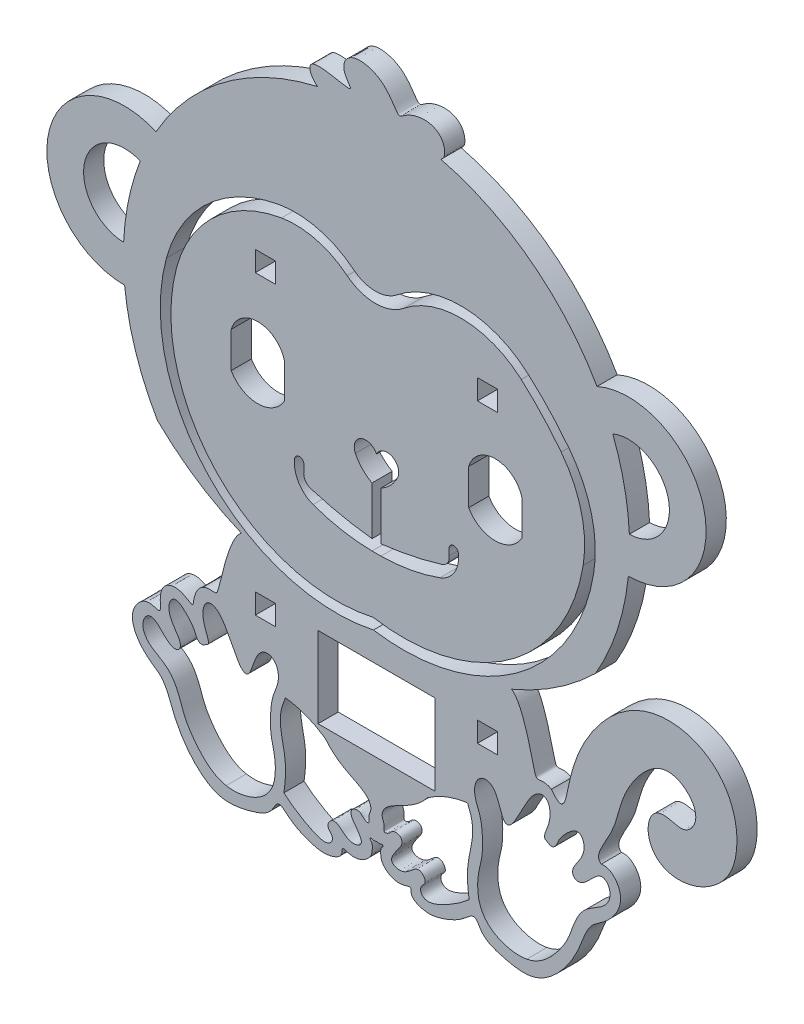
from build123d import *

# Parameters (mm, degrees)
MODEL_W               = 4.75
MODEL_H               = 4.75
MODEL_W_2             = 27.5
MODEL_H_2             = 19
BOSS_EXTRUDE1_DEPTH   = 4.75
BOSS_EXTRUDE1_2_DEPTH = 4.75


with BuildPart() as part:
    # Model → Boss-Extrude1 (new body)
    with BuildSketch(Plane.XY):
        with BuildLine():
            ThreePointArc((-368.648535438, 496.252173352), (-390.614540969, 486.143224047), (-406.641533995, 468.037099404))
            ThreePointArc((-406.641533995, 468.037099404), (-431.911918909, 455.12113969), (-414.015985287, 433.095020448))
            ThreePointArc((-414.015985287, 433.095020448), (-411.431056442, 420.844790734), (-406.306877408, 409.421447336))
            add(Edge.make_bspline(
                [(-406.306877408, 409.421447336), (-400.570314381, 403.800956643), (-393.8462394, 399.364042204), (-386.551251239, 396.327251189)],
                knots=[0, 0, 0, 0, 0.429948541, 0.429948541, 0.429948541, 0.429948541], degree=3))
            add(Edge.make_bspline(
                [(-386.551251239, 396.327251189), (-386.916052394, 396.079204413), (-387.365984237, 395.634433922), (-387.896797281, 394.898644088), (-388.503330161, 393.757203334), (-389.171452603, 392.131003368), (-389.577925954, 391.014654975), (-389.970270784, 389.819275468), (-390.419319319, 388.323421516), (-390.83332726, 386.804935246), (-391.201587088, 385.34636593), (-391.516679205, 384.035346949), (-391.781698399, 382.944281063), (-391.975355466, 382.209449772), (-392.15403089, 381.664820315), (-392.336737386, 381.31109681), (-392.551498562, 381.129911234), (-392.833479669, 381.082225409), (-393.211479982, 381.115525432), (-393.693425125, 381.169472404), (-394.261194431, 381.182617586), (-394.881047474, 381.099420015), (-395.510435114, 380.877573231), (-396.105936728, 380.494485307), (-396.631517428, 379.95585235), (-397.063963964, 379.297531395), (-397.39210439, 378.573969962), (-397.617276013, 377.849585475), (-397.753517497, 377.188797135), (-397.82736951, 376.647023839), (-397.879059879, 376.260334721), (-397.959633552, 376.038465419), (-398.114782848, 375.972462073), (-398.366034123, 376.040823891), (-398.706936261, 376.21469148), (-399.120091801, 376.460086445), (-399.591458011, 376.741171495), (-400.117952431, 377.022315753), (-400.699774201, 377.268862798), (-401.463798734, 377.484035353), (-402.300244633, 377.553822048), (-403.174091852, 377.426716269), (-404.002173047, 377.065864722), (-404.698224792, 376.46441147), (-405.153470998, 375.811835942), (-405.461269956, 375.032169593), (-405.619922332, 374.166940367), (-405.657953521, 373.27889911), (-405.626485489, 372.442499072), (-405.587522811, 371.731075977), (-405.603727217, 371.205296174), (-405.727364814, 370.900755869), (-405.990085682, 370.81668236), (-406.39105056, 370.902146782), (-406.905602715, 371.07475403), (-407.496249881, 371.243305804), (-408.122207542, 371.327500075), (-408.751072773, 371.282728006), (-409.35960202, 371.097539496), (-409.931191749, 370.782809916), (-410.454421679, 370.36348433), (-410.921225043, 369.869653892), (-411.325051593, 369.32694511), (-411.659572418, 368.750331411), (-411.919102239, 368.147846593), (-412.098696202, 367.522400938), (-412.194371621, 366.874422897), (-412.203287138, 366.20397783), (-412.092164868, 365.237355517), (-411.795780763, 364.240492853), (-411.25356719, 363.0979097), (-410.505546493, 362.004000685), (-409.628552466, 361.020862692), (-408.940714048, 360.363039305), (-408.261699769, 359.795455705), (-407.719269628, 359.383631865), (-407.21381394, 359.028246689), (-406.753242924, 358.71792316), (-406.337217025, 358.432587935), (-405.958407604, 358.146100067), (-405.606436892, 357.832150323), (-405.270933307, 357.469037169), (-404.945150571, 357.045248498), (-404.628769556, 356.563710073), (-404.325203667, 356.036561227), (-404.039420225, 355.480831591), (-403.775511082, 354.913678765), (-403.486293011, 354.234906798), (-403.22438966, 353.563780813), (-402.971971356, 352.893055429), (-402.704512752, 352.203026621), (-402.401681187, 351.478012783), (-402.062584898, 350.721085445), (-401.674639208, 349.927966936), (-401.239024686, 349.111007443), (-400.763113802, 348.289788183), (-400.254340005, 347.481959495), (-399.722634495, 346.692998852), (-399.163365939, 345.932140679), (-398.574323946, 345.19923963), (-397.949478676, 344.488835597), (-397.28186749, 343.797089708), (-396.693729261, 343.232918759), (-395.94666487, 342.573889335), (-395.145878925, 341.947793479), (-394.290902186, 341.375211916), (-393.384167186, 340.882126765), (-392.430043668, 340.491703263), (-391.606002687, 340.243986907), (-390.756002743, 340.079446261), (-389.883129061, 339.998262902), (-388.990604918, 339.995014447), (-388.082210988, 340.060658996), (-387.162607569, 340.183979577), (-386.237707408, 340.353267946), (-385.315001235, 340.557855636), (-384.403963907, 340.789827334), (-383.516286063, 341.045384095), (-382.66652457, 341.327024633), (-381.871318875, 341.642937555), (-381.146754324, 342.002777686), (-380.506140062, 342.414272763), (-379.957720387, 342.879646699), (-379.50217975, 343.391768319), (-379.130782998, 343.931240964), (-378.821858803, 344.461005534), (-378.544703377, 344.932108886), (-378.267774642, 345.29593373), (-377.965518245, 345.51436395), (-377.625879138, 345.570992742), (-377.257148561, 345.481328236), (-376.875804119, 345.278776475), (-376.496250149, 345.00253689), (-376.11706805, 344.682307942), (-375.720845967, 344.335154988), (-375.283150649, 343.970625574), (-374.779103973, 343.593551859), (-374.190278948, 343.207542556), (-373.377688666, 342.741091189), (-372.449841911, 342.284943077), (-371.448923671, 341.861784637), (-370.434447105, 341.496921291), (-369.457107924, 341.211628122), (-368.685864943, 341.035221995), (-367.964373903, 340.924859402), (-367.285516994, 340.881136877), (-366.635919607, 340.902071878), (-366.001452121, 340.984188477), (-365.373937537, 341.123915256), (-364.75630659, 341.318535957), (-364.170945702, 341.568094094), (-363.657947564, 341.87428189), (-363.258368215, 342.235110671), (-362.999601239, 342.639822419), (-362.882834785, 343.065290294), (-362.862380856, 343.467877411), (-362.860328863, 343.794256059), (-362.800804618, 344.002021381), (-362.645316427, 344.082202864), (-362.403915174, 344.064482859), (-362.091030238, 343.983757423), (-361.712216892, 343.868949898), (-361.271123238, 343.746963048), (-360.772201451, 343.643387937), (-360.225145899, 343.584551667), (-359.643851104, 343.593953505), (-359.045609545, 343.68889199), (-358.331130904, 343.914571841), (-357.653031997, 344.271758954), (-357.055699253, 344.71601695), (-356.577458743, 345.17871164), (-356.233391408, 345.621031596), (-356.033125086, 345.975351534), (-355.902737419, 346.342883089), (-355.820827463, 346.757252518), (-355.769760706, 347.236551212), (-355.745106949, 347.759570584), (-355.762413964, 348.248781386), (-355.838587496, 348.623368474), (-355.977712536, 348.837568218), (-356.150848594, 348.941800594), (-356.292732028, 349.075710758), (-356.33646563, 349.288102762), (-356.236344626, 349.443149765), (-355.997125235, 349.455364951), (-355.677539018, 349.382302231), (-355.345578077, 349.318848286), (-355.1000792, 349.319880609), (-354.932396923, 349.356987082), (-354.827970147, 349.397996872), (-354.777593989, 349.422562594)],
                knots=[0, 0, 0, 0, 0, 0, 0.02, 0.025, 0.03, 0.035, 0.04, 0.045, 0.05, 0.06, 0.065, 0.07, 0.075, 0.08, 0.085, 0.09, 0.095, 0.1, 0.105, 0.11, 0.115, 0.12, 0.125, 0.13, 0.135, 0.14, 0.145, 0.15, 0.155, 0.16, 0.165, 0.17, 0.175, 0.18, 0.185, 0.19, 0.195, 0.2, 0.205, 0.21, 0.22, 0.225, 0.23, 0.235, 0.24, 0.245, 0.25, 0.255, 0.26, 0.265, 0.27, 0.275, 0.28, 0.285, 0.29, 0.295, 0.3, 0.305, 0.31, 0.315, 0.32, 0.325, 0.33, 0.335, 0.34, 0.345, 0.35, 0.355, 0.36, 0.375, 0.38, 0.39, 0.395, 0.4, 0.405, 0.41, 0.415, 0.42, 0.425, 0.43, 0.435, 0.44, 0.445, 0.45, 0.455, 0.46, 0.465, 0.47, 0.48, 0.485, 0.49, 0.495, 0.5, 0.51, 0.515, 0.52, 0.525, 0.53, 0.54, 0.545, 0.55, 0.555, 0.56, 0.565, 0.575, 0.58, 0.585, 0.59, 0.595, 0.6, 0.605, 0.61, 0.615, 0.62, 0.625, 0.63, 0.635, 0.64, 0.645, 0.65, 0.655, 0.66, 0.665, 0.67, 0.675, 0.68, 0.685, 0.69, 0.695, 0.7, 0.705, 0.71, 0.715, 0.72, 0.725, 0.73, 0.735, 0.74, 0.745, 0.755, 0.76, 0.765, 0.77, 0.775, 0.78, 0.785, 0.79, 0.795, 0.8, 0.805, 0.81, 0.815, 0.82, 0.825, 0.83, 0.835, 0.84, 0.845, 0.85, 0.855, 0.86, 0.865, 0.87, 0.875, 0.88, 0.885, 0.89, 0.895, 0.905, 0.91, 0.915, 0.92, 0.925, 0.93, 0.935, 0.94, 0.945, 0.95, 0.955, 0.96, 0.965, 0.97, 0.975, 0.98, 0.985, 0.99, 0.995, 1, 1, 1, 1, 1, 1], degree=5))
            add(Edge.make_bspline(
                [(-354.777593989, 349.422562594), (-354.727217831, 349.397996872), (-354.622791055, 349.356987082), (-354.455108777, 349.319880609), (-354.2096099, 349.318848286), (-353.87764896, 349.382302231), (-353.558062742, 349.455364951), (-353.318843352, 349.443149765), (-353.218722348, 349.288102762), (-353.262455949, 349.075710758), (-353.404339383, 348.941800594), (-353.577475441, 348.837568218), (-353.716600481, 348.623368474), (-353.792774013, 348.248781386), (-353.810081029, 347.759570584), (-353.785427271, 347.236551212), (-353.734360514, 346.757252518), (-353.652450559, 346.342883089), (-353.522062892, 345.975351534), (-353.321796569, 345.621031596), (-352.977729235, 345.17871164), (-352.499488725, 344.71601695), (-351.902155981, 344.271758954), (-351.224057074, 343.914571841), (-350.509578433, 343.68889199), (-349.911336873, 343.593953505), (-349.330042079, 343.584551667), (-348.782986526, 343.643387937), (-348.284064739, 343.746963048), (-347.842971085, 343.868949898), (-347.46415774, 343.983757423), (-347.151272803, 344.064482859), (-346.909871551, 344.082202864), (-346.754383359, 344.002021381), (-346.694859114, 343.794256059), (-346.692807122, 343.467877411), (-346.672353193, 343.065290294), (-346.555586738, 342.639822419), (-346.296819762, 342.235110671), (-345.897240413, 341.87428189), (-345.384242276, 341.568094094), (-344.798881387, 341.318535957), (-344.18125044, 341.123915256), (-343.553735856, 340.984188477), (-342.91926837, 340.902071878), (-342.269670984, 340.881136877), (-341.590814074, 340.924859402), (-340.869323035, 341.035221995), (-340.098080053, 341.211628122), (-339.120740873, 341.496921291), (-338.106264306, 341.861784637), (-337.105346067, 342.284943077), (-336.177499311, 342.741091189), (-335.364909029, 343.207542556), (-334.776084004, 343.593551859), (-334.272037329, 343.970625574), (-333.83434201, 344.335154988), (-333.438119927, 344.682307942), (-333.058937829, 345.00253689), (-332.679383858, 345.278776475), (-332.298039416, 345.481328236), (-331.929308839, 345.570992742), (-331.589669732, 345.51436395), (-331.287413335, 345.29593373), (-331.0104846, 344.932108886), (-330.733329174, 344.461005534), (-330.42440498, 343.931240964), (-330.053008227, 343.391768319), (-329.59746759, 342.879646699), (-329.049047915, 342.414272763), (-328.408433654, 342.002777686), (-327.683869103, 341.642937555), (-326.888663407, 341.327024633), (-326.038901914, 341.045384095), (-325.151224071, 340.789827334), (-324.240186742, 340.557855636), (-323.31748057, 340.353267946), (-322.392580408, 340.183979577), (-321.472976989, 340.060658996), (-320.564583059, 339.995014447), (-319.672058916, 339.998262902), (-318.799185234, 340.079446261), (-317.949185291, 340.243986907), (-317.125144309, 340.491703263), (-316.171020791, 340.882126765), (-315.264285791, 341.375211916), (-314.409309053, 341.947793479), (-313.608523108, 342.573889335), (-312.861458716, 343.232918759), (-312.273320488, 343.797089708), (-311.605709301, 344.488835597), (-310.980864031, 345.19923963), (-310.391822039, 345.932140679), (-309.832553482, 346.692998852), (-309.300847972, 347.481959495), (-308.792074176, 348.289788183), (-308.316163291, 349.111007443), (-307.88054877, 349.927966936), (-307.492603079, 350.721085445), (-307.15350679, 351.478012783), (-306.850675225, 352.203026621), (-306.583216622, 352.893055429), (-306.330798317, 353.563780813), (-306.068894967, 354.234906798), (-305.779676896, 354.913678765), (-305.515767753, 355.480831591), (-305.22998431, 356.036561227), (-304.926418421, 356.563710073), (-304.610037406, 357.045248498), (-304.28425467, 357.469037169), (-303.948751085, 357.832150323), (-303.596780374, 358.146100067), (-303.217970952, 358.432587935), (-302.801945054, 358.71792316), (-302.341374037, 359.028246689), (-301.83591835, 359.383631865), (-301.293488209, 359.795455705), (-300.61447393, 360.363039305), (-299.926635511, 361.020862692), (-299.049641484, 362.004000685), (-298.301620787, 363.0979097), (-297.759407215, 364.240492853), (-297.463023109, 365.237355517), (-297.35190084, 366.20397783), (-297.360816357, 366.874422897), (-297.456491776, 367.522400938), (-297.636085738, 368.147846593), (-297.89561556, 368.750331411), (-298.230136384, 369.32694511), (-298.633962934, 369.869653892), (-299.100766299, 370.36348433), (-299.623996228, 370.782809916), (-300.195585957, 371.097539496), (-300.773941346, 371.273545454), (-301.244905456, 371.313674079), (-301.589974955, 371.293910279), (-301.80670497, 371.265018138), (-301.898947089, 371.249991702)],
                knots=[0.707071068, 0.707071068, 0.707071068, 0.707071068, 0.707071068, 0.707071068, 0.712071068, 0.717071068, 0.722071068, 0.727071068, 0.732071068, 0.737071068, 0.742071068, 0.747071068, 0.752071068, 0.757071068, 0.762071068, 0.767071068, 0.772071068, 0.777071068, 0.782071068, 0.787071068, 0.792071068, 0.797071068, 0.802071068, 0.812071068, 0.817071068, 0.822071068, 0.827071068, 0.832071068, 0.837071068, 0.842071068, 0.847071068, 0.852071068, 0.857071068, 0.862071068, 0.867071068, 0.872071068, 0.877071068, 0.882071068, 0.887071068, 0.892071068, 0.897071068, 0.902071068, 0.907071068, 0.912071068, 0.917071068, 0.922071068, 0.927071068, 0.932071068, 0.937071068, 0.942071068, 0.947071068, 0.952071068, 0.962071068, 0.967071068, 0.972071068, 0.977071068, 0.982071068, 0.987071068, 0.992071068, 0.997071068, 1.002071068, 1.007071068, 1.012071068, 1.017071068, 1.022071068, 1.027071068, 1.032071068, 1.037071068, 1.042071068, 1.047071068, 1.052071068, 1.057071068, 1.062071068, 1.067071068, 1.072071068, 1.077071068, 1.082071068, 1.087071068, 1.092071068, 1.097071068, 1.102071068, 1.107071068, 1.112071068, 1.117071068, 1.122071068, 1.127071068, 1.132071068, 1.142071068, 1.147071068, 1.152071068, 1.157071068, 1.162071068, 1.167071068, 1.177071068, 1.182071068, 1.187071068, 1.192071068, 1.197071068, 1.207071068, 1.212071068, 1.217071068, 1.222071068, 1.227071068, 1.237071068, 1.242071068, 1.247071068, 1.252071068, 1.257071068, 1.262071068, 1.267071068, 1.272071068, 1.277071068, 1.282071068, 1.287071068, 1.292071068, 1.297071068, 1.302071068, 1.307071068, 1.312071068, 1.317071068, 1.327071068, 1.332071068, 1.347071068, 1.352071068, 1.357071068, 1.362071068, 1.367071068, 1.372071068, 1.377071068, 1.382071068, 1.387071068, 1.392071068, 1.397071068, 1.402071068, 1.407071068, 1.412071068, 1.415831446, 1.415831446, 1.415831446, 1.415831446, 1.415831446, 1.415831446], degree=5))
            add(Edge.make_bspline(
                [(-301.898947089, 371.249991702), (-302.03777992, 371.337842664), (-302.278358106, 371.535036125), (-302.527935786, 371.895313524), (-302.638326758, 372.504569396), (-302.422921716, 373.473093417), (-301.910810817, 374.622658725), (-301.203239072, 375.907021068), (-300.417430607, 377.272852531), (-299.663776374, 378.670412259), (-299.023340821, 380.063869225), (-298.518808306, 381.445147803), (-298.11469187, 382.832378816), (-297.742815902, 384.255163919), (-297.321372994, 385.743083541), (-296.774951218, 387.313965856), (-296.05819531, 388.959584105), (-295.162040147, 390.642897503), (-294.101045993, 392.307630147), (-292.906052001, 393.884476201), (-291.614267711, 395.298727975), (-290.261394711, 396.477163759), (-288.870633099, 397.355559995), (-287.450506474, 397.88487723), (-286.008600232, 398.034757091), (-284.562929688, 397.798008073), (-283.152043236, 397.193839546), (-281.851079655, 396.27377504), (-280.76403377, 395.118025382), (-279.993445178, 393.822748232), (-279.614594112, 392.489509944), (-279.651481692, 391.214486489), (-280.042701572, 390.076155472), (-280.672983329, 389.134306182), (-281.424791372, 388.432592409), (-282.224227316, 388.000042889), (-283.086509475, 387.852497186), (-284.061898655, 387.966698541), (-285.187617596, 388.257647228), (-286.432799241, 388.549506411), (-287.714778317, 388.627521421), (-288.922339625, 388.299673225), (-289.935960884, 387.451354667), (-290.650627543, 386.112012698), (-290.983205819, 384.420926362), (-290.877596402, 382.578851159), (-290.311010342, 380.803687119), (-289.299028152, 379.286710653), (-287.903220924, 378.142688713), (-286.219105708, 377.4170411), (-284.360670175, 377.103581142), (-282.445893609, 377.158636255), (-280.582328457, 377.516407907), (-278.851525965, 378.104383008), (-277.297305988, 378.856918007), (-275.93548394, 379.717384281), (-274.760882323, 380.641693853), (-273.755463023, 381.601444913), (-272.895776168, 382.586894991), (-272.161214125, 383.610945588), (-271.535866394, 384.70099922), (-271.009722971, 385.888830428), (-270.579877607, 387.201933377), (-270.252293644, 388.652401735), (-270.040978563, 390.2346489), (-269.965016257, 391.930118455), (-270.046205794, 393.710009769), (-270.306480744, 395.538773505), (-270.857132325, 397.745077765), (-271.727774145, 399.906931327), (-272.937052277, 401.94602382), (-274.485083983, 403.787796033), (-276.348901152, 405.366769995), (-278.092782759, 406.4785487), (-280.379149882, 407.539092006), (-283.265109328, 408.344541641), (-286.299006859, 408.594090842), (-289.32996603, 408.269637229), (-292.650761978, 407.269272218), (-295.374305071, 405.888080142), (-297.55376872, 404.384775694), (-299.570759796, 402.614165823), (-301.423227661, 400.629872898), (-302.855961089, 398.859622636), (-304.437971019, 396.623488316), (-305.836320205, 394.276384281), (-307.030109551, 391.853114628), (-308.001652746, 389.39378453), (-308.755268533, 386.963327702), (-309.250925564, 385.001542652), (-309.640561499, 383.162221439), (-309.968617434, 381.523898785), (-310.292721218, 380.178229359), (-310.673366326, 379.216827317), (-311.16584039, 378.72093299), (-311.809926861, 378.748147162), (-312.461695262, 379.21039337), (-313.030249288, 379.809050666), (-313.444699739, 380.320105618), (-313.6607794, 380.60362174)],
                knots=[0.011105874, 0.011105874, 0.011105874, 0.011105874, 0.011105874, 0.011105874, 0.021105874, 0.031105874, 0.041105874, 0.051105874, 0.061105874, 0.071105874, 0.081105874, 0.091105874, 0.101105874, 0.111105874, 0.121105874, 0.131105874, 0.141105874, 0.151105874, 0.161105874, 0.171105874, 0.181105874, 0.191105874, 0.201105874, 0.211105874, 0.221105874, 0.231105874, 0.241105874, 0.251105874, 0.261105874, 0.271105874, 0.281105874, 0.291105874, 0.301105874, 0.311105874, 0.321105874, 0.331105874, 0.341105874, 0.351105874, 0.361105874, 0.371105874, 0.381105874, 0.391105874, 0.401105874, 0.411105874, 0.421105874, 0.431105874, 0.441105874, 0.451105874, 0.461105874, 0.471105874, 0.481105874, 0.491105874, 0.501105874, 0.511105874, 0.521105874, 0.531105874, 0.541105874, 0.551105874, 0.561105874, 0.571105874, 0.581105874, 0.591105874, 0.601105874, 0.611105874, 0.621105874, 0.631105874, 0.641105874, 0.651105874, 0.661105874, 0.671105874, 0.681105874, 0.701105874, 0.711105874, 0.721105874, 0.731105874, 0.741105874, 0.751105874, 0.771105874, 0.791105874, 0.801105874, 0.811105874, 0.831105874, 0.841105874, 0.851105874, 0.861105874, 0.871105874, 0.881105874, 0.901105874, 0.911105874, 0.921105874, 0.931105874, 0.941105874, 0.951105874, 0.961105874, 0.971105874, 0.981105874, 0.991105874, 1.001105874, 1.011105874, 1.011105874, 1.011105874, 1.011105874, 1.011105874, 1.011105874], degree=5))
            add(Edge.make_bspline(
                [(-313.6607794, 380.60362174), (-313.737120758, 380.657216991), (-313.932453608, 380.783648044), (-314.256472836, 380.951412883), (-314.716438841, 381.105097359), (-315.293993546, 381.182617586), (-315.861762853, 381.169472404), (-316.343707995, 381.115525432), (-316.721708308, 381.082225409), (-317.003689416, 381.129911234), (-317.218450591, 381.31109681), (-317.401157087, 381.664820315), (-317.579832511, 382.209449772), (-317.773489578, 382.944281063), (-318.038508773, 384.035346949), (-318.353600889, 385.34636593), (-318.721860717, 386.804935246), (-319.135868658, 388.323421516), (-319.584917193, 389.819275468), (-319.977262023, 391.014654975), (-320.383735374, 392.131003368), (-321.051857816, 393.757203334), (-321.658390696, 394.898644088), (-322.18920374, 395.634433922), (-322.639135583, 396.079204413), (-323.003936738, 396.327251189)],
                knots=[0.083874227, 0.083874227, 0.083874227, 0.083874227, 0.083874227, 0.083874227, 0.087168245, 0.092168245, 0.097168245, 0.102168245, 0.107168245, 0.112168245, 0.117168245, 0.122168245, 0.127168245, 0.132168245, 0.137168245, 0.142168245, 0.147168245, 0.157168245, 0.162168245, 0.167168245, 0.172168245, 0.177168245, 0.182168245, 0.187168245, 0.207168245, 0.207168245, 0.207168245, 0.207168245, 0.207168245, 0.207168245], degree=5))
            add(Edge.make_bspline(
                [(-303.24831057, 409.421447336), (-308.985021441, 403.782578576), (-315.709130953, 399.362076466), (-323.003936738, 396.327251189)],
                knots=[0, 0, 0, 0, 0.419257817, 0.419257817, 0.419257817, 0.419257817], degree=3))
            ThreePointArc((-303.24831057, 409.421447336), (-298.124131535, 420.844790734), (-295.53920269, 433.095020448))
            ThreePointArc((-295.53920269, 433.095020448), (-277.643269068, 455.12113969), (-302.913653982, 468.037099404))
            ThreePointArc((-302.913653982, 468.037099404), (-318.490243046, 485.80537303), (-339.811140885, 495.991686882))
            add(Edge.make_bspline(
                [(-368.648535438, 496.252173352), (-368.744458236, 496.318852064), (-368.933155722, 496.46135137), (-369.206763211, 496.702529524), (-369.552638711, 497.078952875), (-369.945448044, 497.635151945), (-370.27396009, 498.258937778), (-370.49029081, 498.914952019), (-370.51070775, 499.541563445), (-370.238365938, 500.064302422), (-369.5990972, 500.417471707), (-368.57162488, 500.562380095), (-367.22355688, 500.508813977), (-365.687080465, 500.304348965), (-364.130399482, 500.021394498), (-362.730437113, 499.744991582), (-361.645780778, 499.560560003), (-360.987783845, 499.541133492), (-360.796409046, 499.736067669), (-361.003653893, 500.155847055), (-361.456239643, 500.775355547), (-361.969645158, 501.546412025), (-362.368346783, 502.406968262), (-362.540769792, 503.292531993), (-362.454363932, 504.143316727), (-362.127001431, 504.906996063), (-361.609010526, 505.54285956), (-360.962354705, 506.024792223), (-360.237689537, 506.346315269), (-359.465109655, 506.519028644), (-358.662050204, 506.563781119), (-357.836770513, 506.503364206), (-356.993360104, 506.355416269), (-356.136711355, 506.123246396), (-355.27524615, 505.794703449), (-354.419874931, 505.352916652), (-353.583850229, 504.783872945), (-352.782377599, 504.085819177), (-352.032065864, 503.276653785), (-351.351103862, 502.405268117), (-350.756796891, 501.550400765), (-350.259062752, 500.800910062), (-349.854900796, 500.240489256), (-349.52240587, 499.930593307), (-349.215031159, 499.894076524), (-348.855526802, 500.098537748), (-348.362085472, 500.475509867), (-347.67170771, 500.938251599), (-346.770031422, 501.402187782), (-345.688786994, 501.792289415), (-344.48987856, 502.045099565), (-343.253856136, 502.112491058), (-342.066559862, 501.964757688), (-341.006667622, 501.593968073), (-340.132609258, 501.01739116), (-339.470394525, 500.280534755), (-339.021946768, 499.447136213), (-338.772548612, 498.589873373), (-338.698846344, 497.780410896), (-338.775989921, 497.080683391), (-338.986639614, 496.531262609), (-339.255348506, 496.227388525), (-339.511863577, 496.0787419), (-339.707309513, 496.014838841), (-339.811140885, 495.991686882)],
                knots=[0, 0, 0, 0, 0, 0, 0.016666667, 0.033333333, 0.05, 0.066666667, 0.083333333, 0.1, 0.116666667, 0.133333333, 0.15, 0.166666667, 0.183333333, 0.2, 0.216666667, 0.233333333, 0.25, 0.266666667, 0.283333333, 0.3, 0.316666667, 0.333333333, 0.35, 0.366666667, 0.383333333, 0.4, 0.416666667, 0.433333333, 0.45, 0.466666667, 0.483333333, 0.5, 0.516666667, 0.533333333, 0.55, 0.566666667, 0.583333333, 0.6, 0.616666667, 0.633333333, 0.65, 0.666666667, 0.683333333, 0.7, 0.716666667, 0.733333333, 0.75, 0.766666667, 0.783333333, 0.8, 0.816666667, 0.833333333, 0.85, 0.866666667, 0.883333333, 0.9, 0.916666667, 0.933333333, 0.95, 0.966666667, 0.983333333, 1, 1, 1, 1, 1, 1], degree=5))
        make_face()
        with BuildLine():
            ThreePointArc((-360.109228344, 463.172409636), (-355.023574668, 461.376916772), (-349.937920992, 463.172409636))
            ThreePointArc((-349.937920992, 463.172409636), (-334.363025482, 468.457169262), (-319.066098648, 462.414811781))
            ThreePointArc((-319.066098648, 462.414811781), (-313.967508105, 457.426827427), (-309.355065595, 451.986148468))
            ThreePointArc((-309.355065595, 451.986148468), (-304.195997116, 441.351918834), (-303.701700245, 429.542664071))
            ThreePointArc((-303.701700245, 429.542664071), (-321.886124129, 400.161128565), (-355.495007283, 392.136736143))
            ThreePointArc((-355.495007283, 392.136736143), (-394.275586165, 404.171275171), (-404.186485857, 443.548140148))
            ThreePointArc((-404.186485857, 443.548140148), (-394.39888219, 459.530167412), (-377.543979657, 467.723740602))
            ThreePointArc((-377.543979657, 467.723740602), (-368.337482707, 467.321748595), (-360.109228344, 463.172409636))
        make_face(mode=Mode.SUBTRACT)
        with BuildLine():
            ThreePointArc((-414.252942121, 441.734311673), (-423.460915188, 453.337573366), (-410.349392029, 460.23035295))
            ThreePointArc((-410.349392029, 460.23035295), (-413.050642353, 451.140507471), (-414.252942121, 441.734311673))
        make_face(mode=Mode.SUBTRACT)
        with BuildLine():
            ThreePointArc((-299.205795948, 460.23035295), (-286.094272789, 453.337573366), (-295.302245857, 441.734311673))
            ThreePointArc((-295.302245857, 441.734311673), (-296.504545624, 451.140507471), (-299.205795948, 460.23035295))
        make_face(mode=Mode.SUBTRACT)
        with BuildLine():
            add(Edge.make_bspline(
                [(-333.358122308, 367.977740368), (-333.290361755, 367.817629105), (-333.133298943, 367.441678276), (-332.892890082, 366.840557198), (-332.595150463, 365.999616132), (-332.308638357, 364.902314582), (-332.141475525, 363.717945794), (-332.114335112, 362.267537937), (-332.281096871, 360.786670891), (-332.577187909, 359.282111454), (-332.905983076, 357.76060121), (-333.18090921, 356.233101176), (-333.340506426, 354.963686123), (-333.415008014, 353.708196346), (-333.40709761, 352.479644492), (-333.331839528, 351.292328084), (-333.220115887, 350.231627248), (-333.120659299, 349.444474437), (-333.050486962, 348.89971713), (-333.009033396, 348.569813497), (-332.992682366, 348.437505192)],
                knots=[0.622689336, 0.622689336, 0.622689336, 0.622689336, 0.622689336, 0.622689336, 0.636363636, 0.654545455, 0.672727273, 0.690909091, 0.709090909, 0.727272727, 0.763636364, 0.781818182, 0.8, 0.818181818, 0.836363636, 0.854545455, 0.872727273, 0.890909091, 0.909090909, 0.921584179, 0.921584179, 0.921584179, 0.921584179, 0.921584179, 0.921584179], degree=5))
            add(Edge.make_bspline(
                [(-332.992682366, 348.437505192), (-333.343906027, 348.120225507), (-333.824014458, 347.716485488), (-334.461763337, 347.22129098), (-335.410749998, 346.543868926), (-336.610270124, 345.771998966), (-337.458184455, 345.259957762), (-338.343593105, 344.761342502), (-339.250749884, 344.294800143), (-340.011503719, 343.939797535), (-340.765327108, 343.634781861), (-341.498336387, 343.399927626), (-342.194270163, 343.260954616), (-342.834629803, 343.243972112), (-343.399118517, 343.367622612), (-343.865755872, 343.635447226), (-344.211639018, 344.029575024), (-344.412105815, 344.500185277), (-344.449574676, 344.981402433), (-344.325623899, 345.415675437), (-344.071473621, 345.774651042), (-343.760441191, 346.083203626), (-343.482450899, 346.39137192), (-343.319866626, 346.74756162), (-343.317818146, 347.165732087), (-343.474111314, 347.614172754), (-343.760566074, 348.038856641), (-344.136137174, 348.377905457), (-344.565239035, 348.581358079), (-345.021850964, 348.617777675), (-345.489937542, 348.477625624), (-345.965019622, 348.177624601), (-346.455316716, 347.764787306), (-346.974988325, 347.304390919), (-347.537500463, 346.868148382), (-348.148507051, 346.521731015), (-348.799947954, 346.3138942), (-349.461067954, 346.26156111), (-350.083419649, 346.353244449), (-350.61345873, 346.562395215), (-351.00279517, 346.857729309), (-351.219399114, 347.214683036), (-351.258452451, 347.62667992), (-351.136866367, 348.093952582), (-350.887549147, 348.613530102), (-350.5539714, 349.166006251), (-350.18403631, 349.712749097), (-349.823472616, 350.212078335), (-349.508405403, 350.632740674), (-349.260221636, 350.965468466), (-349.074676373, 351.242664974), (-348.931979078, 351.525794368), (-348.820413046, 351.868880998), (-348.764412599, 352.280184356), (-348.821881816, 352.714550499), (-349.042131897, 353.107205211), (-349.433490862, 353.39695829), (-349.928679216, 353.55286338), (-350.43120263, 353.567779583), (-350.855375074, 353.453836876), (-351.175249595, 353.236892523), (-351.449806581, 352.952298114), (-351.75531192, 352.646442123), (-352.140488528, 352.375452202), (-352.554274133, 352.209421056), (-352.889463887, 352.210981478), (-353.055293049, 352.410622381), (-353.061864589, 352.771916741), (-353.002652586, 353.211349774), (-352.983205519, 353.643748358), (-353.052664249, 354.030016958), (-353.188312578, 354.38437775), (-353.336896028, 354.741225182), (-353.441501476, 355.131727418), (-353.469045518, 355.561390098), (-353.400841378, 356.021587578), (-353.229005451, 356.495751946), (-352.949742575, 356.968761067), (-352.561183433, 357.430599339), (-352.06414823, 357.875827209), (-351.462176863, 358.304193598), (-350.621751689, 358.804014305), (-349.324079297, 359.468262445), (-347.827421903, 360.190063829), (-346.226641396, 361.09120286), (-344.708489977, 362.244490628), (-343.643340024, 363.307588234), (-343.163184304, 363.85297617), (-342.873464627, 364.209853009), (-342.762777342, 364.350534764)],
                knots=[0, 0, 0, 0, 0, 0, 0.025806452, 0.032258065, 0.038709677, 0.051612903, 0.058064516, 0.064516129, 0.070967742, 0.077419355, 0.083870968, 0.090322581, 0.096774194, 0.103225806, 0.109677419, 0.116129032, 0.122580645, 0.129032258, 0.135483871, 0.141935484, 0.148387097, 0.15483871, 0.161290323, 0.167741935, 0.174193548, 0.180645161, 0.187096774, 0.193548387, 0.2, 0.206451613, 0.212903226, 0.219354839, 0.225806452, 0.232258065, 0.238709677, 0.24516129, 0.251612903, 0.258064516, 0.264516129, 0.270967742, 0.277419355, 0.283870968, 0.290322581, 0.296774194, 0.303225806, 0.309677419, 0.316129032, 0.322580645, 0.329032258, 0.335483871, 0.341935484, 0.348387097, 0.35483871, 0.361290323, 0.367741935, 0.374193548, 0.380645161, 0.387096774, 0.393548387, 0.4, 0.406451613, 0.412903226, 0.419354839, 0.425806452, 0.432258065, 0.438709677, 0.44516129, 0.451612903, 0.458064516, 0.464516129, 0.470967742, 0.477419355, 0.483870968, 0.490322581, 0.496774194, 0.503225806, 0.509677419, 0.516129032, 0.522580645, 0.529032258, 0.535483871, 0.541935484, 0.55483871, 0.574193548, 0.580645161, 0.587096774, 0.591157882, 0.591157882, 0.591157882, 0.591157882, 0.591157882, 0.591157882], degree=5))
            add(Edge.make_bspline(
                [(-342.762777342, 364.350534764), (-338.494372375, 367.353364408), (-333.358122308, 367.977740368)],
                knots=[0, 0, 0, 1, 1, 1], degree=2))
        make_face(mode=Mode.SUBTRACT)
        with BuildLine():
            add(Edge.make_bspline(
                [(-314.620749745, 369.427141197), (-314.560869496, 369.393694465), (-314.439406747, 369.323231887), (-314.25435186, 369.205963501), (-313.999175477, 369.049059854), (-313.639514767, 368.96228854), (-313.243772968, 369.05266282), (-312.867198913, 369.296818527), (-312.566493663, 369.638109808), (-312.355288256, 370.031321462), (-312.183415676, 370.470969369), (-311.979484465, 370.965320575), (-311.677269873, 371.523827157), (-311.253906037, 372.136488917), (-310.724041929, 372.776291707), (-310.124744446, 373.405964272), (-309.503010445, 373.983472804), (-308.903200413, 374.467756401), (-308.352069048, 374.825041115), (-307.85316693, 375.032596821), (-307.400412858, 375.077436111), (-306.986434606, 374.956091264), (-306.615337983, 374.674043003), (-306.241851206, 374.159153747), (-305.991401765, 373.45481656), (-305.908375909, 372.614503172), (-306.018552266, 371.706592574), (-306.316615194, 370.792556948), (-306.746650406, 369.903188647), (-307.297117261, 369.067459771), (-307.873722413, 368.287790221), (-308.352369418, 367.541354924), (-308.633192445, 366.82229305), (-308.701476483, 366.249950673), (-308.597124845, 365.733913369), (-308.336555286, 365.316865027), (-307.949804733, 365.040677921), (-307.472255596, 364.932958267), (-306.937317982, 364.997789251), (-306.374555523, 365.222794685), (-305.807104565, 365.582978418), (-305.248627483, 366.046427552), (-304.703416257, 366.576910123), (-304.169742976, 367.134285153), (-303.642325088, 367.675350292), (-303.115110784, 368.154791688), (-302.584025782, 368.525412241), (-302.049440966, 368.741054182), (-301.518428068, 368.765301234), (-301.006537237, 368.577973557), (-300.540957443, 368.184578151), (-300.158898698, 367.617206787), (-299.899146356, 366.923507596), (-299.795084514, 366.158393197), (-299.867517088, 365.37492459), (-300.116543845, 364.614814659), (-300.525360787, 363.907440054), (-301.065729665, 363.27022419), (-301.702976631, 362.708413577), (-302.400904798, 362.21536138), (-303.127429354, 361.771973185), (-303.857507146, 361.348674367), (-304.571518808, 360.911545733), (-305.254722293, 360.427364396), (-305.896240146, 359.869372997), (-306.488329703, 359.222074162), (-307.025328111, 358.488088839), (-307.503554824, 357.687574538), (-307.92212185, 356.850340326), (-308.283471212, 356.010062881), (-308.594085486, 355.19740745), (-308.864984381, 354.434165567), (-309.162188817, 353.583920768), (-309.45691258, 352.795182696), (-309.796093543, 352.019554247), (-310.224480782, 351.196068109), (-310.767604281, 350.293454826), (-311.407207108, 349.328017099), (-312.163219261, 348.302684751), (-313.020175493, 347.260083174), (-313.953484522, 346.259171413), (-314.940627096, 345.355050282), (-316.130280192, 344.422738814), (-317.191236711, 343.80769483), (-318.102217115, 343.439020767), (-319.038532445, 343.180939517), (-319.999582408, 343.028236756), (-320.583572728, 342.967707619), (-321.376243859, 342.946857306), (-322.384885875, 343.014997219), (-323.807134551, 343.236698219), (-325.214939101, 343.641910776), (-326.550552446, 344.223813718), (-327.748476077, 344.979464947), (-328.906787655, 346.035358043), (-329.629493387, 346.944013166), (-330.19424847, 347.961697243), (-330.599650706, 349.073767667), (-330.854186474, 350.253722226), (-330.973126803, 351.264493725), (-331.009454922, 352.279020573), (-330.976347397, 353.269629207), (-330.88859231, 354.209682362), (-330.761725042, 355.077615763), (-330.611087025, 355.861598991), (-330.450963098, 356.563394055), (-330.293575206, 357.203852866), (-330.14848505, 357.823641742), (-330.023148695, 358.470784905), (-329.923277207, 359.190100998), (-329.853247546, 360.012872436), (-329.809215024, 361.130304648), (-329.819431944, 362.372856991), (-329.887794372, 363.655455816), (-330.015163924, 364.867116082), (-330.198513912, 365.931592632), (-330.385607264, 366.70281676), (-330.602518095, 367.373585475), (-330.842075343, 367.985451255), (-331.092754567, 368.590711564), (-331.336959046, 369.239249071), (-331.549754254, 369.965442058), (-331.696295386, 370.772442178), (-331.737206236, 371.635014477), (-331.636270912, 372.508141031), (-331.367532792, 373.333696933), (-330.922240507, 374.0479019), (-330.316819153, 374.588503724), (-329.5975841, 374.901867677), (-328.826491023, 374.948150462), (-328.06876195, 374.706982557), (-327.380499095, 374.182420302), (-326.677449504, 373.254892134), (-326.130522201, 372.056560651), (-325.700988456, 370.765146298), (-325.30804039, 369.593054623), (-324.877092799, 368.725944485), (-324.46454894, 368.281145381), (-323.989479873, 368.158447053), (-323.459698085, 368.370729166), (-322.890400557, 368.904588223), (-322.297267583, 369.72357846), (-321.687566024, 370.772114999), (-321.061713393, 371.980364433), (-320.4162037, 373.269490843), (-319.746050641, 374.556751319), (-319.047468577, 375.760679867), (-318.320368682, 376.806173903), (-317.571127626, 377.629761625), (-316.81479176, 378.184472383), (-316.078611127, 378.445659533), (-315.401440985, 378.41385339), (-314.823930473, 378.110857069), (-314.380461194, 377.577272045), (-314.090624368, 376.869327521), (-313.950263182, 376.056351297), (-313.938004639, 375.210811153), (-314.022472312, 374.398450101), (-314.169621226, 373.667548502), (-314.34916434, 373.040450995), (-314.543549317, 372.49932284), (-314.745282776, 371.997828498), (-314.945543525, 371.492203965), (-315.127811479, 370.961065205), (-315.253867465, 370.442483774), (-315.275168701, 370.013247589), (-315.15934743, 369.732447323), (-314.968422891, 369.609058619), (-314.798688245, 369.523912276), (-314.680629995, 369.460587928), (-314.620749745, 369.427141197)],
                knots=[0.497142857, 0.497142857, 0.497142857, 0.497142857, 0.497142857, 0.497142857, 0.502857143, 0.508571429, 0.514285714, 0.52, 0.525714286, 0.531428571, 0.537142857, 0.542857143, 0.548571429, 0.554285714, 0.56, 0.565714286, 0.571428571, 0.577142857, 0.582857143, 0.588571429, 0.594285714, 0.6, 0.605714286, 0.611428571, 0.617142857, 0.622857143, 0.634285714, 0.64, 0.645714286, 0.651428571, 0.657142857, 0.668571429, 0.674285714, 0.68, 0.685714286, 0.691428571, 0.697142857, 0.702857143, 0.708571429, 0.714285714, 0.72, 0.725714286, 0.731428571, 0.737142857, 0.742857143, 0.748571429, 0.754285714, 0.76, 0.765714286, 0.771428571, 0.777142857, 0.782857143, 0.788571429, 0.794285714, 0.8, 0.805714286, 0.811428571, 0.817142857, 0.822857143, 0.828571429, 0.834285714, 0.84, 0.845714286, 0.851428571, 0.857142857, 0.862857143, 0.868571429, 0.874285714, 0.88, 0.885714286, 0.891428571, 0.897142857, 0.902857143, 0.908571429, 0.914285714, 0.925714286, 0.931428571, 0.937142857, 0.942857143, 0.948571429, 0.96, 0.965714286, 0.971428571, 0.977142857, 0.982857143, 1, 1, 1, 1.005714286, 1.011428571, 1.017142857, 1.022857143, 1.028571429, 1.045714286, 1.051428571, 1.057142857, 1.062857143, 1.074285714, 1.08, 1.085714286, 1.091428571, 1.097142857, 1.102857143, 1.108571429, 1.114285714, 1.12, 1.125714286, 1.131428571, 1.137142857, 1.142857143, 1.148571429, 1.154285714, 1.16, 1.165714286, 1.177142857, 1.182857143, 1.188571429, 1.194285714, 1.2, 1.205714286, 1.211428571, 1.217142857, 1.222857143, 1.228571429, 1.234285714, 1.24, 1.245714286, 1.251428571, 1.257142857, 1.262857143, 1.268571429, 1.274285714, 1.28, 1.285714286, 1.291428571, 1.302857143, 1.308571429, 1.314285714, 1.32, 1.325714286, 1.331428571, 1.337142857, 1.342857143, 1.348571429, 1.354285714, 1.36, 1.365714286, 1.371428571, 1.377142857, 1.382857143, 1.388571429, 1.394285714, 1.4, 1.405714286, 1.411428571, 1.417142857, 1.422857143, 1.428571429, 1.434285714, 1.44, 1.445714286, 1.451428571, 1.457142857, 1.462857143, 1.468571429, 1.474285714, 1.48, 1.485714286, 1.491428571, 1.497142857, 1.497142857, 1.497142857, 1.497142857, 1.497142857, 1.497142857], degree=5))
        make_face(mode=Mode.SUBTRACT)
        with Locations((-380.902593989, 383.655620444)):
            Rectangle(MODEL_W, MODEL_H, mode=Mode.SUBTRACT)
        with Locations((-328.652593989, 383.655620444)):
            Rectangle(MODEL_W, MODEL_H, mode=Mode.SUBTRACT)
        with Locations((-354.777593989, 376.030620444)):
            Rectangle(MODEL_W_2, MODEL_H_2, mode=Mode.SUBTRACT)
        with BuildLine():
            add(Edge.make_bspline(
                [(-366.792410636, 364.350534764), (-371.060815602, 367.353364408), (-376.19706567, 367.977740368)],
                knots=[0, 0, 0, 1, 1, 1], degree=2))
            add(Edge.make_bspline(
                [(-376.562505611, 348.437505192), (-376.211281951, 348.120225507), (-375.731173519, 347.716485488), (-375.093424641, 347.22129098), (-374.144437979, 346.543868926), (-372.944917853, 345.771998966), (-372.097003522, 345.259957762), (-371.211594872, 344.761342502), (-370.304438094, 344.294800143), (-369.543684259, 343.939797535), (-368.789860869, 343.634781861), (-368.056851591, 343.399927626), (-367.360917815, 343.260954616), (-366.720558174, 343.243972112), (-366.15606946, 343.367622612), (-365.689432105, 343.635447226), (-365.343548959, 344.029575024), (-365.143082163, 344.500185277), (-365.105613301, 344.981402433), (-365.229564079, 345.415675437), (-365.483714356, 345.774651042), (-365.794746786, 346.083203626), (-366.072737078, 346.39137192), (-366.235321351, 346.74756162), (-366.237369831, 347.165732087), (-366.081076663, 347.614172754), (-365.794621903, 348.038856641), (-365.419050804, 348.377905457), (-364.989948942, 348.581358079), (-364.533337013, 348.617777675), (-364.065250436, 348.477625624), (-363.590168355, 348.177624601), (-363.099871262, 347.764787306), (-362.580199652, 347.304390919), (-362.017687514, 346.868148382), (-361.406680926, 346.521731015), (-360.755240023, 346.3138942), (-360.094120023, 346.26156111), (-359.471768328, 346.353244449), (-358.941729247, 346.562395215), (-358.552392807, 346.857729309), (-358.335788863, 347.214683036), (-358.296735527, 347.62667992), (-358.41832161, 348.093952582), (-358.66763883, 348.613530102), (-359.001216577, 349.166006251), (-359.371151667, 349.712749097), (-359.731715361, 350.212078335), (-360.046782575, 350.632740674), (-360.294966341, 350.965468466), (-360.480511604, 351.242664974), (-360.623208899, 351.525794368), (-360.734774931, 351.868880998), (-360.790775378, 352.280184356), (-360.733306162, 352.714550499), (-360.51305608, 353.107205211), (-360.121697115, 353.39695829), (-359.626508761, 353.55286338), (-359.123985347, 353.567779583), (-358.699812903, 353.453836876), (-358.379938382, 353.236892523), (-358.105381396, 352.952298114), (-357.799876057, 352.646442123), (-357.414699449, 352.375452202), (-357.000913845, 352.209421056), (-356.66572409, 352.210981478), (-356.499894928, 352.410622381), (-356.493323388, 352.771916741), (-356.552535391, 353.211349774), (-356.571982458, 353.643748358), (-356.502523728, 354.030016958), (-356.366875399, 354.38437775), (-356.21829195, 354.741225182), (-356.113686501, 355.131727418), (-356.086142459, 355.561390098), (-356.154346599, 356.021587578), (-356.326182526, 356.495751946), (-356.605445402, 356.968761067), (-356.994004544, 357.430599339), (-357.491039748, 357.875827209), (-358.093011115, 358.304193598), (-358.933436288, 358.804014305), (-360.23110868, 359.468262445), (-361.727766074, 360.190063829), (-363.328546581, 361.09120286), (-364.846698001, 362.244490628), (-365.911847953, 363.307588234), (-366.392003673, 363.85297617), (-366.68172335, 364.209853009), (-366.792410636, 364.350534764)],
                knots=[0, 0, 0, 0, 0, 0, 0.025806452, 0.032258065, 0.038709677, 0.051612903, 0.058064516, 0.064516129, 0.070967742, 0.077419355, 0.083870968, 0.090322581, 0.096774194, 0.103225806, 0.109677419, 0.116129032, 0.122580645, 0.129032258, 0.135483871, 0.141935484, 0.148387097, 0.15483871, 0.161290323, 0.167741935, 0.174193548, 0.180645161, 0.187096774, 0.193548387, 0.2, 0.206451613, 0.212903226, 0.219354839, 0.225806452, 0.232258065, 0.238709677, 0.24516129, 0.251612903, 0.258064516, 0.264516129, 0.270967742, 0.277419355, 0.283870968, 0.290322581, 0.296774194, 0.303225806, 0.309677419, 0.316129032, 0.322580645, 0.329032258, 0.335483871, 0.341935484, 0.348387097, 0.35483871, 0.361290323, 0.367741935, 0.374193548, 0.380645161, 0.387096774, 0.393548387, 0.4, 0.406451613, 0.412903226, 0.419354839, 0.425806452, 0.432258065, 0.438709677, 0.44516129, 0.451612903, 0.458064516, 0.464516129, 0.470967742, 0.477419355, 0.483870968, 0.490322581, 0.496774194, 0.503225806, 0.509677419, 0.516129032, 0.522580645, 0.529032258, 0.535483871, 0.541935484, 0.55483871, 0.574193548, 0.580645161, 0.587096774, 0.591157882, 0.591157882, 0.591157882, 0.591157882, 0.591157882, 0.591157882], degree=5))
            add(Edge.make_bspline(
                [(-376.19706567, 367.977740368), (-376.264826222, 367.817629105), (-376.421889035, 367.441678276), (-376.662297896, 366.840557198), (-376.960037514, 365.999616132), (-377.246549621, 364.902314582), (-377.413712452, 363.717945794), (-377.440852865, 362.267537937), (-377.274091107, 360.786670891), (-376.978000068, 359.282111454), (-376.649204901, 357.76060121), (-376.374278767, 356.233101176), (-376.214681551, 354.963686123), (-376.140179964, 353.708196346), (-376.148090367, 352.479644492), (-376.223348449, 351.292328084), (-376.335072091, 350.231627248), (-376.434528678, 349.444474437), (-376.504701016, 348.89971713), (-376.546154582, 348.569813497), (-376.562505611, 348.437505192)],
                knots=[0.622689336, 0.622689336, 0.622689336, 0.622689336, 0.622689336, 0.622689336, 0.636363636, 0.654545455, 0.672727273, 0.690909091, 0.709090909, 0.727272727, 0.763636364, 0.781818182, 0.8, 0.818181818, 0.836363636, 0.854545455, 0.872727273, 0.890909091, 0.909090909, 0.921584179, 0.921584179, 0.921584179, 0.921584179, 0.921584179, 0.921584179], degree=5))
        make_face(mode=Mode.SUBTRACT)
        with BuildLine():
            add(Edge.make_bspline(
                [(-390.130998815, 343.125127337), (-390.703918598, 343.232555767), (-391.452970862, 343.439020767), (-392.363951266, 343.80769483), (-393.424907785, 344.422738814), (-394.614560881, 345.355050282), (-395.601703455, 346.259171413), (-396.535012484, 347.260083174), (-397.391968716, 348.302684751), (-398.147980869, 349.328017099), (-398.787583696, 350.293454826), (-399.330707195, 351.196068109), (-399.759094435, 352.019554247), (-400.098275398, 352.795182696), (-400.39299916, 353.583920768), (-400.690203596, 354.434165567), (-400.961102492, 355.19740745), (-401.271716766, 356.010062881), (-401.633066127, 356.850340326), (-402.051633154, 357.687574538), (-402.529859866, 358.488088839), (-403.066858274, 359.222074162), (-403.658947831, 359.869372997), (-404.300465685, 360.427364396), (-404.98366917, 360.911545733), (-405.697680832, 361.348674367), (-406.427758623, 361.771973185), (-407.154283179, 362.21536138), (-407.852211346, 362.708413577), (-408.489458312, 363.27022419), (-409.02982719, 363.907440054), (-409.438644133, 364.614814659), (-409.687670889, 365.37492459), (-409.760103463, 366.158393197), (-409.656041622, 366.923507596), (-409.396289279, 367.617206787), (-409.014230534, 368.184578151), (-408.54865074, 368.577973557), (-408.036759909, 368.765301234), (-407.505747011, 368.741054182), (-406.971162195, 368.525412241), (-406.440077193, 368.154791688), (-405.912862889, 367.675350292), (-405.385445002, 367.134285153), (-404.85177172, 366.576910123), (-404.306560494, 366.046427552), (-403.748083413, 365.582978418), (-403.180632454, 365.222794685), (-402.617869995, 364.997789251), (-402.082932381, 364.932958267), (-401.605383244, 365.040677921), (-401.218632692, 365.316865027), (-400.958063133, 365.733913369), (-400.853711495, 366.249950673), (-400.921995532, 366.82229305), (-401.202818559, 367.541354924), (-401.681465564, 368.287790221), (-402.258070716, 369.067459771), (-402.808537571, 369.903188647), (-403.238572783, 370.792556948), (-403.536635711, 371.706592574), (-403.646812068, 372.614503172), (-403.563786212, 373.45481656), (-403.313336771, 374.159153747), (-402.939849994, 374.674043003), (-402.568753372, 374.956091264), (-402.154775119, 375.077436111), (-401.702021047, 375.032596821), (-401.203118929, 374.825041115), (-400.651987565, 374.467756401), (-400.052177533, 373.983472804), (-399.430443531, 373.405964272), (-398.831146049, 372.776291707), (-398.30128194, 372.136488917), (-397.877918104, 371.523827157), (-397.575703513, 370.965320575), (-397.371772301, 370.470969369), (-397.199899722, 370.031321462), (-396.988694315, 369.638109808), (-396.687989064, 369.296818527), (-396.31141501, 369.05266282), (-395.91567321, 368.96228854), (-395.556012501, 369.049059854), (-395.237042022, 369.245189413), (-394.932132432, 369.440409306), (-394.634496221, 369.578211443), (-394.395840548, 369.732447323), (-394.280019277, 370.013247589), (-394.301320512, 370.442483774), (-394.427376498, 370.961065205), (-394.609644453, 371.492203965), (-394.809905202, 371.997828498), (-395.01163866, 372.49932284), (-395.206023637, 373.040450995), (-395.385566751, 373.667548502), (-395.532715665, 374.398450101), (-395.617183338, 375.210811153), (-395.604924795, 376.056351297), (-395.464563609, 376.869327521), (-395.174726783, 377.577272045), (-394.731257504, 378.110857069), (-394.153746992, 378.41385339), (-393.476576851, 378.445659533), (-392.740396217, 378.184472383), (-391.984060351, 377.629761625), (-391.234819295, 376.806173903), (-390.5077194, 375.760679867), (-389.809137336, 374.556751319), (-389.138984277, 373.269490843), (-388.493474584, 371.980364433), (-387.867621954, 370.772114999), (-387.257920394, 369.72357846), (-386.664787421, 368.904588223), (-386.095489892, 368.370729166), (-385.565708104, 368.158447053), (-385.090639038, 368.281145381), (-384.678095178, 368.725944485), (-384.247147588, 369.593054623), (-383.854199521, 370.765146298), (-383.424665777, 372.056560651), (-382.877738473, 373.254892134), (-382.174688882, 374.182420302), (-381.486426027, 374.706982557), (-380.728696955, 374.948150462), (-379.957603878, 374.901867677), (-379.238368825, 374.588503724), (-378.632947471, 374.0479019), (-378.187655185, 373.333696933), (-377.918917065, 372.508141031), (-377.817981741, 371.635014477), (-377.858892591, 370.772442178), (-378.005433723, 369.965442058), (-378.218228931, 369.239249071), (-378.46243341, 368.590711564), (-378.713112635, 367.985451255), (-378.952669882, 367.373585475), (-379.169580713, 366.70281676), (-379.356674066, 365.931592632), (-379.540024053, 364.867116082), (-379.667393605, 363.655455816), (-379.735756033, 362.372856991), (-379.745972953, 361.130304648), (-379.701940431, 360.012872436), (-379.631910771, 359.190100998), (-379.532039282, 358.470784905), (-379.406702927, 357.823641742), (-379.261612771, 357.203852866), (-379.10422488, 356.563394055), (-378.944100952, 355.861598991), (-378.793462935, 355.077615763), (-378.666595667, 354.209682362), (-378.578840581, 353.269629207), (-378.545733055, 352.279020573), (-378.582061174, 351.264493725), (-378.701001503, 350.253722226), (-378.955537272, 349.073767667), (-379.360939507, 347.961697243), (-379.92569459, 346.944013166), (-380.648400322, 346.035358043), (-381.8067119, 344.979464947), (-383.004635531, 344.223813718), (-384.340248876, 343.641910776), (-385.748053426, 343.236698219), (-387.170302102, 343.014997219), (-388.178944118, 342.946857306), (-388.971615249, 342.967707619), (-389.555605569, 343.028236756), (-389.940025554, 343.08931786), (-390.130998815, 343.125127337)],
                knots=[0.497142857, 0.497142857, 0.497142857, 0.497142857, 0.497142857, 0.497142857, 0.514285714, 0.52, 0.525714286, 0.531428571, 0.537142857, 0.548571429, 0.554285714, 0.56, 0.565714286, 0.571428571, 0.582857143, 0.588571429, 0.594285714, 0.6, 0.605714286, 0.611428571, 0.617142857, 0.622857143, 0.628571429, 0.634285714, 0.64, 0.645714286, 0.651428571, 0.657142857, 0.662857143, 0.668571429, 0.674285714, 0.68, 0.685714286, 0.691428571, 0.697142857, 0.702857143, 0.708571429, 0.714285714, 0.72, 0.725714286, 0.731428571, 0.737142857, 0.742857143, 0.748571429, 0.754285714, 0.76, 0.765714286, 0.771428571, 0.777142857, 0.782857143, 0.788571429, 0.794285714, 0.8, 0.805714286, 0.811428571, 0.817142857, 0.822857143, 0.828571429, 0.84, 0.845714286, 0.851428571, 0.857142857, 0.862857143, 0.874285714, 0.88, 0.885714286, 0.891428571, 0.897142857, 0.902857143, 0.908571429, 0.914285714, 0.92, 0.925714286, 0.931428571, 0.937142857, 0.942857143, 0.948571429, 0.954285714, 0.96, 0.965714286, 0.971428571, 0.977142857, 0.982857143, 0.988571429, 0.994285714, 1, 1.005714286, 1.011428571, 1.017142857, 1.022857143, 1.028571429, 1.034285714, 1.04, 1.045714286, 1.051428571, 1.057142857, 1.062857143, 1.068571429, 1.074285714, 1.08, 1.085714286, 1.091428571, 1.097142857, 1.102857143, 1.108571429, 1.114285714, 1.12, 1.125714286, 1.131428571, 1.137142857, 1.142857143, 1.148571429, 1.154285714, 1.16, 1.165714286, 1.171428571, 1.177142857, 1.182857143, 1.188571429, 1.194285714, 1.205714286, 1.211428571, 1.217142857, 1.222857143, 1.228571429, 1.234285714, 1.24, 1.245714286, 1.251428571, 1.257142857, 1.262857143, 1.268571429, 1.274285714, 1.28, 1.285714286, 1.291428571, 1.297142857, 1.302857143, 1.308571429, 1.314285714, 1.32, 1.331428571, 1.337142857, 1.342857143, 1.348571429, 1.354285714, 1.36, 1.365714286, 1.371428571, 1.377142857, 1.382857143, 1.388571429, 1.394285714, 1.4, 1.405714286, 1.411428571, 1.417142857, 1.422857143, 1.434285714, 1.44, 1.445714286, 1.451428571, 1.468571429, 1.474285714, 1.48, 1.485714286, 1.491428571, 1.497142857, 1.497142857, 1.497142857, 1.497142857, 1.497142857, 1.497142857], degree=5))
        make_face(mode=Mode.SUBTRACT)
    extrude(amount=BOSS_EXTRUDE1_DEPTH)


with BuildPart() as body_2:
    # Model → Boss-Extrude1 2 (new body)
    with BuildSketch(Plane.XY):
        with BuildLine():
            ThreePointArc((-377.125759617, 465.25897043), (-392.718907692, 457.678766407), (-401.773813407, 442.893150342))
            ThreePointArc((-401.773813407, 442.893150342), (-392.30025528, 405.722231405), (-355.564398017, 394.681293524))
            ThreePointArc((-355.564398017, 394.681293524), (-323.538999624, 402.052001342), (-306.168523811, 429.94859694))
            ThreePointArc((-306.168523811, 429.94859694), (-306.620269498, 440.741260648), (-311.335223341, 450.460050404))
            ThreePointArc((-311.335223341, 450.460050404), (-315.7971041, 455.723131887), (-320.729263795, 460.548295857))
            ThreePointArc((-320.729263795, 460.548295857), (-334.424357287, 465.957921693), (-348.368311682, 461.226561078))
            ThreePointArc((-348.368311682, 461.226561078), (-355.023574668, 458.876916772), (-361.678837654, 461.226561078))
            ThreePointArc((-361.678837654, 461.226561078), (-368.96894468, 464.902811685), (-377.125759617, 465.25897043))
        make_face()
        with BuildLine():
            Line((-353.73271066, 421.931811039), (-353.73271066, 410.573646176))
            ThreePointArc((-353.73271066, 410.573646176), (-346.470111899, 411.733059722), (-339.345161275, 413.556424509))
            ThreePointArc((-339.345161275, 413.556424509), (-338.032554222, 414.558549146), (-337.691667275, 416.174404076))
            ThreePointArc((-337.691667275, 416.174404076), (-337.753498381, 417.011299533), (-337.691667275, 417.84819499))
            ThreePointArc((-337.691667275, 417.84819499), (-336.617971967, 418.774152884), (-335.544276658, 417.84819499))
            ThreePointArc((-335.544276658, 417.84819499), (-336.41078905, 413.453016485), (-339.860540362, 410.595105762))
            ThreePointArc((-339.860540362, 410.595105762), (-346.689290481, 408.741340607), (-353.73271066, 408.06421017))
            Line((-353.73271066, 408.06421017), (-353.73271066, 408.062962171))
            Line((-353.73271066, 408.062962171), (-355.822477317, 408.062962171))
            Line((-355.822477317, 408.062962171), (-355.822477317, 408.06421017))
            ThreePointArc((-355.822477317, 408.06421017), (-362.865897496, 408.741340607), (-369.694647616, 410.595105762))
            ThreePointArc((-369.694647616, 410.595105762), (-373.144398928, 413.453016485), (-374.010911319, 417.84819499))
            ThreePointArc((-374.010911319, 417.84819499), (-372.937216011, 418.774152884), (-371.863520702, 417.84819499))
            ThreePointArc((-371.863520702, 417.84819499), (-371.801689596, 417.011299533), (-371.863520702, 416.174404076))
            ThreePointArc((-371.863520702, 416.174404076), (-371.522633755, 414.558549146), (-370.210026702, 413.556424509))
            ThreePointArc((-370.210026702, 413.556424509), (-363.085076078, 411.733059722), (-355.822477317, 410.573646176))
            Line((-355.822477317, 410.573646176), (-355.822477317, 421.931811039))
            ThreePointArc((-355.822477317, 421.931811039), (-358.111503022, 423.652557275), (-359.744159816, 426.005223439))
            ThreePointArc((-359.744159816, 426.005223439), (-358.429174909, 429.672325295), (-354.777593989, 428.31483566))
            ThreePointArc((-354.777593989, 428.31483566), (-351.126013068, 429.672325295), (-349.811028161, 426.005223439))
            ThreePointArc((-349.811028161, 426.005223439), (-351.443684955, 423.652557275), (-353.73271066, 421.931811039))
        make_face(mode=Mode.SUBTRACT)
        with BuildLine():
            ThreePointArc((-388.942056735, 436.663420371), (-382.706390205, 441.351358653), (-376.470723674, 436.663420371))
            Line((-376.470723674, 436.663420371), (-376.470723674, 428.258439712))
            ThreePointArc((-376.470723674, 428.258439712), (-382.706390205, 424.618880123), (-388.942056735, 428.258439712))
            Line((-388.942056735, 428.258439712), (-388.942056735, 436.663420371))
        make_face(mode=Mode.SUBTRACT)
        with Locations((-380.902593989, 453.405620444)):
            Rectangle(MODEL_W, MODEL_H, mode=Mode.SUBTRACT)
        with BuildLine():
            ThreePointArc((-320.613131243, 428.258439712), (-326.848797773, 424.618880123), (-333.084464303, 428.258439712))
            Line((-333.084464303, 428.258439712), (-333.084464303, 436.663420371))
            ThreePointArc((-333.084464303, 436.663420371), (-326.848797773, 441.351358653), (-320.613131243, 436.663420371))
            Line((-320.613131243, 436.663420371), (-320.613131243, 428.258439712))
        make_face(mode=Mode.SUBTRACT)
        with Locations((-328.652593989, 453.405620444)):
            Rectangle(MODEL_W, MODEL_H, mode=Mode.SUBTRACT)
    extrude(amount=BOSS_EXTRUDE1_2_DEPTH)


solid = Compound([part.part, body_2.part])
